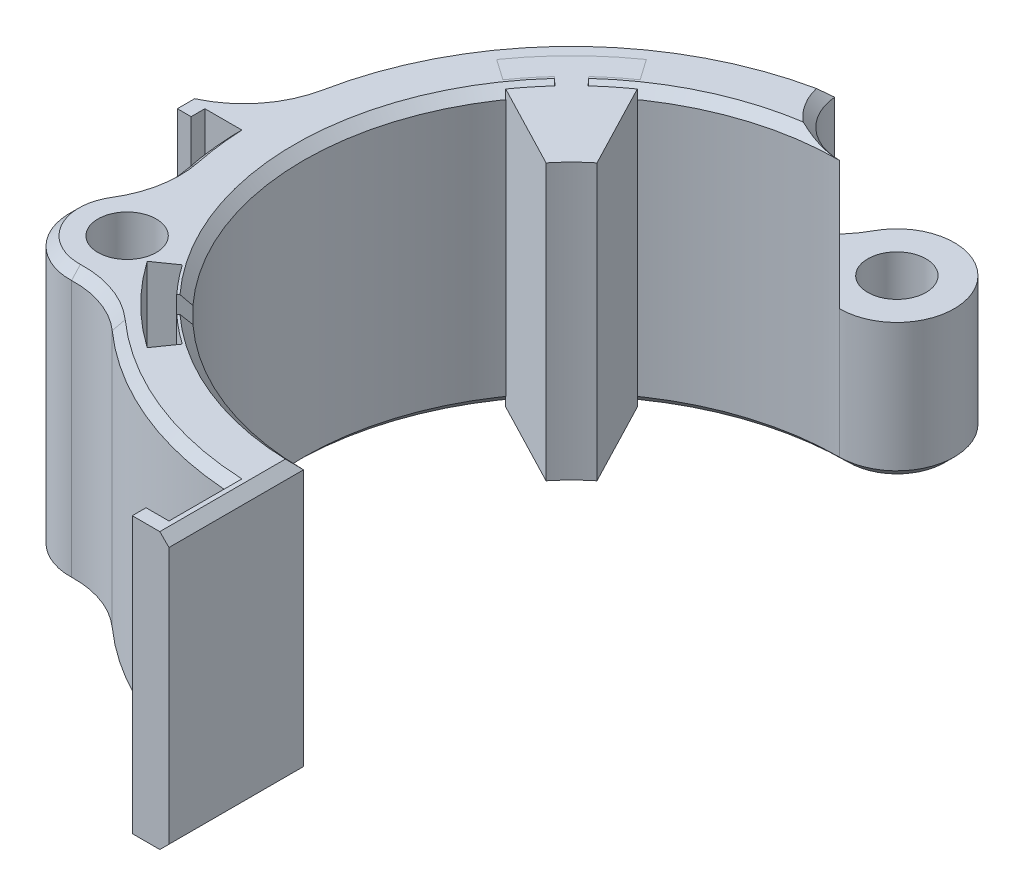
from build123d import *

# Parameters (mm, degrees)
SKETCH3_R           = 3.175
BOSS_EXTRUDE2_DEPTH = 30
SKETCH3_6_R         = 6.25
SKETCH3_6_R_2       = 3.175
BOSS_EXTRUDE3_DEPTH = 15
FILLET1_R           = 10
CHAMFER1_SIZE       = 1
JAW_SLOT_DEPTH      = 67.475644682
TPU_JAW_DEPTH       = 30
SLOT_PATTERN_COUNT  = 2
SLOT_PATTERN_ANGLE  = 90


with BuildPart() as part:
    # Sketch3 → Boss-Extrude2 (new body)
    with BuildSketch(Plane(origin=(0, 0, 0), x_dir=(1, 0, 0), z_dir=(0, 1, 0))):
        with BuildLine():
            ThreePointArc((0, 29.1949759), (-4.220104361, 30.834854515), (-6.225661875, 34.893945761))
            ThreePointArc((-6.225661875, 34.893945761), (-27.175492191, 22.756074809), (-35.4449759, 0))
            Line((-35.4449759, 0), (-39.9449759, 0))
            Line((-39.9449759, 0), (-39.9449759, -3))
            Line((-39.9449759, -3), (-38.4449759, -3))
            Line((-38.4449759, -3), (-38.4449759, -1.5))
            Line((-38.4449759, -1.5), (-35.413222341, -1.5))
            ThreePointArc((-35.413222341, -1.5), (-34.775367062, -6.857124927), (-33.331874405, -12.055391541))
            ThreePointArc((-33.331874405, -12.055391541), (-36.10890834, -20.84748795), (-27.10621253, -22.83855422))
            ThreePointArc((-27.10621253, -22.83855422), (-16.071961789, -31.591745137), (-2.5, -35.356701155))
            Line((-2.5, -35.356701155), (-2.5, -42.356701155))
            Line((-2.5, -42.356701155), (-4, -42.356701155))
            Line((-4, -42.356701155), (-4, -43.856701155))
            Line((-4, -43.856701155), (0, -43.856701155))
            Line((0, -43.856701155), (0, -29.1949759))
            ThreePointArc((0, -29.1949759), (-29.1949759, 0), (0, 29.1949759))
        make_face()
        with Locations(Location((-30.696249566, -17.72248795, 0), (0, 0, 270))):
            Circle(SKETCH3_R, mode=Mode.SUBTRACT)
    extrude(amount=BOSS_EXTRUDE2_DEPTH)

    # Sketch3<6> → Boss-Extrude3 (add)
    with BuildSketch(Plane(origin=(0, 0, 0), x_dir=(1, 0, 0), z_dir=(0, 1, 0))):
        with Locations((0, 35.4449759)):
            Circle(SKETCH3_6_R)
        with Locations(Location((0, 35.4449759, 0), (0, 0, 270))):
            Circle(SKETCH3_6_R_2, mode=Mode.SUBTRACT)
    extrude(amount=BOSS_EXTRUDE3_DEPTH)

    # Fillet1
    # the kernel refuses this fillet: 10 mm, written as the material it adds along each edge
    with BuildSketch(Plane(origin=(-27.10621253, 0, 22.83855422), x_dir=(0.6976659907384, 0, 0.7164231747835959), z_dir=(0, 1, 0))) as fillet1_piece_1:
        with BuildLine():
            CenterArc((5.817172713, -9.974107894), FILLET1_R, 94.123965917, 43.409086789)
            ThreePointArc((-1.559496763, -3.222460137), (-0.544085424, -1.725278219), (0, 0))
            ThreePointArc((0, 0), (2.549013098, -0.091774506), (5.098026196, 0))
        make_face()
    extrude(amount=30)
    with BuildSketch(Plane(origin=(-33.331874405, 0, 12.055391541), x_dir=(-0.27160767385328266, 0, -0.9624080587276942), z_dir=(0, 1, 0))) as fillet1_piece_2:
        with BuildLine():
            CenterArc((5.817172713, 9.974107894), FILLET1_R, 222.466947294, 43.409086789)
            ThreePointArc((-1.559496763, 3.222460137), (-0.544085424, 1.725278219), (0, 0))
            ThreePointArc((0, 0), (2.549013098, 0.091774506), (5.098026196, 0))
        make_face()
    extrude(amount=30)
    with BuildSketch(Plane(origin=(-6.225661875, 0, -34.893945761), x_dir=(-0.9692736645916937, 0, 0.24598488394409268), z_dir=(0, 1, 0))) as fillet1_piece_3:
        with BuildLine():
            CenterArc((5.817172713, -9.974107894), FILLET1_R, 94.123965917, 43.409086789)
            ThreePointArc((-1.559496763, -3.222460137), (-0.544085424, -1.725278219), (0, 0))
            ThreePointArc((0, 0), (2.549013098, -0.091774506), (5.098026196, 0))
        make_face()
    extrude(amount=15)
    with BuildSketch(Plane(origin=(-35.4449759, 0, 0), x_dir=(-1, 0, 0), z_dir=(0, 1, 0))) as fillet1_piece_4:
        with BuildLine():
            CenterArc((9.126923994, -8.865188907), FILLET1_R, 117.560980045, 51.189901885)
            ThreePointArc((-0.680958838, -6.914436655), (-0.17065051, -3.473943695), (0, 0))
            Line((0, 0), (4.5, 0))
        make_face()
    extrude(amount=30)

    # Chamfer1
    chamfer1_edges = [part.edges().sort_by_distance(p)[0] for p in [
        (-36.569195939, 0, -2.868795874),
        (-36.569195939, 30, -2.868795874),
        (-26.570252382, 0, -23.459923378),
        (-24.814344184, 30, -25.309971143),
        (-7.880536789, 0, -35.477901284),
        (5.363659035, 0, -38.653349594),
        (-29.1949759, 0, 0),
        (0, 0, 36.525838527),
        (-2.5, 0, 38.856701155),
        (-13.758438746, 0, 32.665756991),
        (-26.784495391, 0, 24.563695697),
        (-36.10890834, 0, 20.84748795),
        (-34.665032179, 0, 10.914205587),
        (-35.178454065, 0, 4.338511975),
        (-4.220104361, 30, -30.834854515),
        (-29.1949759, 30, 0),
        (0, 30, 36.525838527),
        (-2.5, 30, 38.856701155),
        (-13.758438746, 30, 32.665756991),
        (-26.784495391, 30, 24.563695697),
        (-36.10890834, 30, 20.84748795),
        (-34.665032179, 30, 10.914205587),
        (-35.178454065, 30, 4.338511975),
    ]]
    chamfer(chamfer1_edges, length=CHAMFER1_SIZE)

    # Sketch4 → jaw_slot (cut, symmetric)
    with BuildSketch(Plane(origin=(0, 30, 0), x_dir=(1, 0, 0), z_dir=(0, 1, 0))):
        with BuildLine():
            ThreePointArc((-17.462520782, 24.939064247), (-21.527848912, 21.527848912), (-24.939064247, 17.462520782))
            Line((-24.939064247, 17.462520782), (-27.191732369, 19.039855981))
            ThreePointArc((-27.191732369, 19.039855981), (-23.47239256, 23.47239256), (-19.039855981, 27.191732369))
            Line((-19.039855981, 27.191732369), (-17.462520782, 24.939064247))
        make_face()
        with BuildLine():
            ThreePointArc((-20.399430037, 22.262071417), (-21.351072217, 21.351072217), (-22.262071417, 20.399430037))
            Line((-22.262071417, 20.399430037), (-21.52479408, 19.72383983))
            ThreePointArc((-21.52479408, 19.72383983), (-22.768708689, 18.273820686), (-23.915124191, 16.745550236))
            Line((-23.915124191, 16.745550236), (-14.751170485, 11.975097884))
            ThreePointArc((-14.751170485, 11.975097884), (-13.435028843, 13.435028843), (-11.975097884, 14.751170485))
            Line((-11.975097884, 14.751170485), (-16.745550236, 23.915124191))
            ThreePointArc((-16.745550236, 23.915124191), (-18.273820686, 22.768708689), (-19.72383983, 21.52479408))
            Line((-19.72383983, 21.52479408), (-20.399430037, 22.262071417))
        make_face()
        with BuildLine():
            ThreePointArc((-20.568327589, 22.446390751), (-21.527848912, 21.527848912), (-22.446390751, 20.568327589))
            Line((-22.446390751, 20.568327589), (-22.262071417, 20.399430037))
            ThreePointArc((-22.262071417, 20.399430037), (-21.351072217, 21.351072217), (-20.399430037, 22.262071417))
            Line((-20.399430037, 22.262071417), (-20.568327589, 22.446390751))
        make_face()
    jaw_slot = extrude(amount=JAW_SLOT_DEPTH, both=True, mode=Mode.SUBTRACT)

    # slot_pattern: jaw_slot ×2 about axis
    slot_pattern_axis = Axis((0, -1.524877817, 0), (0, 1, 0))
    for i in range(1, SLOT_PATTERN_COUNT):
        add(jaw_slot.rotate(slot_pattern_axis, i * SLOT_PATTERN_ANGLE / (SLOT_PATTERN_COUNT - 1)), mode=Mode.SUBTRACT)


with BuildPart() as body_2:
    # Sketch4<3> → tpu_jaw (new body)
    with BuildSketch(Plane(origin=(0, 30, 0), x_dir=(1, 0, 0), z_dir=(0, 1, 0))):
        with BuildLine():
            ThreePointArc((-17.462520782, 24.939064247), (-21.527848912, 21.527848912), (-24.939064247, 17.462520782))
            Line((-24.939064247, 17.462520782), (-27.191732369, 19.039855981))
            ThreePointArc((-27.191732369, 19.039855981), (-23.47239256, 23.47239256), (-19.039855981, 27.191732369))
            Line((-19.039855981, 27.191732369), (-17.462520782, 24.939064247))
        make_face()
        with BuildLine():
            ThreePointArc((-20.399430037, 22.262071417), (-21.351072217, 21.351072217), (-22.262071417, 20.399430037))
            Line((-22.262071417, 20.399430037), (-21.52479408, 19.72383983))
            ThreePointArc((-21.52479408, 19.72383983), (-22.768708689, 18.273820686), (-23.915124191, 16.745550236))
            Line((-23.915124191, 16.745550236), (-14.751170485, 11.975097884))
            ThreePointArc((-14.751170485, 11.975097884), (-13.435028843, 13.435028843), (-11.975097884, 14.751170485))
            Line((-11.975097884, 14.751170485), (-16.745550236, 23.915124191))
            ThreePointArc((-16.745550236, 23.915124191), (-18.273820686, 22.768708689), (-19.72383983, 21.52479408))
            Line((-19.72383983, 21.52479408), (-20.399430037, 22.262071417))
        make_face()
        with BuildLine():
            ThreePointArc((-20.568327589, 22.446390751), (-21.527848912, 21.527848912), (-22.446390751, 20.568327589))
            Line((-22.446390751, 20.568327589), (-22.262071417, 20.399430037))
            ThreePointArc((-22.262071417, 20.399430037), (-21.351072217, 21.351072217), (-20.399430037, 22.262071417))
            Line((-20.399430037, 22.262071417), (-20.568327589, 22.446390751))
        make_face()
    extrude(amount=-TPU_JAW_DEPTH)


solid = Compound([part.part, body_2.part])
